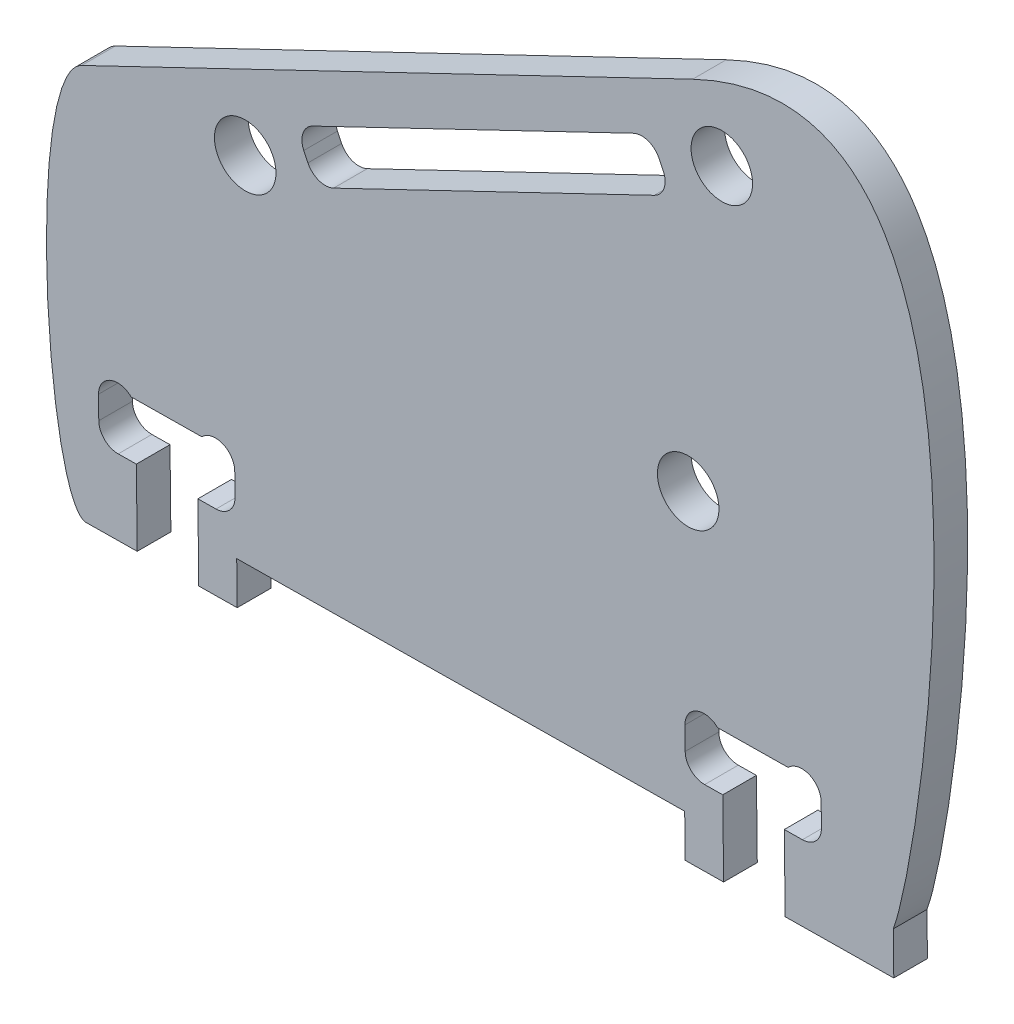
from build123d import *

# Parameters (mm, degrees)
SKETCH2_R        = 1.6
BASE_SHAPE_DEPTH = 1.75


with BuildPart() as part:
    # Sketch2 → Base shape (new body)
    with BuildSketch(Plane(origin=(277.94406545, -368.782269, 0), x_dir=(0.99993266408239, 0.011604624125499034, 0), z_dir=(0, 0, 1))):
        with BuildLine():
            Line((-241.696353273, 405.15495037), (-273.645770216, 390.256692576))
            add(Edge.make_bspline(
                [(-273.645770216, 369.782873115), (-275.704424145, 369.827777388), (-276.708312518, 388.828605647), (-273.645770216, 390.256692576)],
                knots=[0, 0, 0, 0, 1, 1, 1, 1], degree=3))
            Line((-273.645770216, 369.782873115), (-270.995770216, 369.782873115))
            Line((-270.995770216, 369.782873115), (-270.995770216, 373.689979896))
            Line((-270.995770216, 373.689979896), (-271.938663434, 373.689979896))
            ThreePointArc((-271.938663434, 373.689979896), (-272.645770216, 373.982873115), (-272.938663434, 374.689979896))
            Line((-272.938663434, 374.689979896), (-272.938663434, 375.875766334))
            ThreePointArc((-272.938663434, 375.875766334), (-272.321346867, 376.799645866), (-271.231556653, 376.582873115))
            Line((-271.231556653, 376.582873115), (-267.559983778, 376.582873115))
            ThreePointArc((-267.559983778, 376.582873115), (-266.470193564, 376.799645866), (-265.852876997, 375.875766334))
            Line((-265.852876997, 375.875766334), (-265.852876997, 374.689979896))
            ThreePointArc((-265.852876997, 374.689979896), (-266.145770216, 373.982873115), (-266.852876997, 373.689979896))
            Line((-266.852876997, 373.689979896), (-267.795770216, 373.689979896))
            Line((-267.795770216, 373.689979896), (-267.795770216, 369.782873115))
            Line((-267.795770216, 369.782873115), (-265.795770216, 369.782873115))
            Line((-265.795770216, 369.782873115), (-265.795770216, 371.982873115))
            Line((-265.795770216, 371.982873115), (-242.495770216, 371.982873115))
            Line((-242.495770216, 371.982873115), (-242.495770216, 369.782873115))
            Line((-242.495770216, 369.782873115), (-240.495770216, 369.782873115))
            Line((-240.495770216, 369.782873115), (-240.495770216, 373.689979896))
            Line((-240.495770216, 373.689979896), (-241.438663434, 373.689979896))
            ThreePointArc((-241.438663434, 373.689979896), (-242.145770216, 373.982873115), (-242.438663434, 374.689979896))
            Line((-242.438663434, 374.689979896), (-242.438663434, 375.875766334))
            ThreePointArc((-242.438663434, 375.875766334), (-241.821346867, 376.799645866), (-240.731556653, 376.582873115))
            Line((-240.731556653, 376.582873115), (-237.059983778, 376.582873115))
            ThreePointArc((-237.059983778, 376.582873115), (-235.970193564, 376.799645866), (-235.352876997, 375.875766334))
            Line((-235.352876997, 375.875766334), (-235.352876997, 374.689979896))
            ThreePointArc((-235.352876997, 374.689979896), (-235.645770216, 373.982873115), (-236.352876997, 373.689979896))
            Line((-236.352876997, 373.689979896), (-237.295770216, 373.689979896))
            Line((-237.295770216, 373.689979896), (-237.295770216, 369.782873115))
            Line((-237.295770216, 369.782873115), (-231.645770216, 369.782873115))
            Line((-231.645770216, 369.782873115), (-231.645770216, 371.982873115))
            add(Edge.make_bspline(
                [(-241.696353273, 405.15495037), (-223.941946786, 413.433966081), (-230.011047398, 376.161171176), (-231.645770216, 371.982873115)],
                knots=[0, 0, 0, 0, 1, 1, 1, 1], degree=3))
        make_face()
        with Locations((-265.1406535, 390.360870917)):
            Circle(SKETCH2_R, mode=Mode.SUBTRACT)
        with Locations((-242.145770216, 386.482873115)):
            Circle(SKETCH2_R, mode=Mode.SUBTRACT)
        with BuildLine():
            Line((-243.494921177, 400.730286146), (-243.283612046, 400.277132252))
            ThreePointArc((-243.283612046, 400.277132252), (-243.250227212, 399.512493847), (-243.767301571, 398.948206203))
            Line((-243.767301571, 398.948206203), (-260.533995631, 391.129768361))
            ThreePointArc((-260.533995631, 391.129768361), (-261.298634036, 391.096383528), (-261.86292168, 391.613457887))
            Line((-261.86292168, 391.613457887), (-262.074230811, 392.06661178))
            ThreePointArc((-262.074230811, 392.06661178), (-262.107615645, 392.831250185), (-261.590541285, 393.395537829))
            Line((-261.590541285, 393.395537829), (-244.823847225, 401.213975671))
            ThreePointArc((-244.823847225, 401.213975671), (-244.05920882, 401.247360505), (-243.494921177, 400.730286146))
        make_face(mode=Mode.SUBTRACT)
        with Locations((-240.217189356, 401.982873115)):
            Circle(SKETCH2_R, mode=Mode.SUBTRACT)
    extrude(amount=BASE_SHAPE_DEPTH)


solid = part.part
